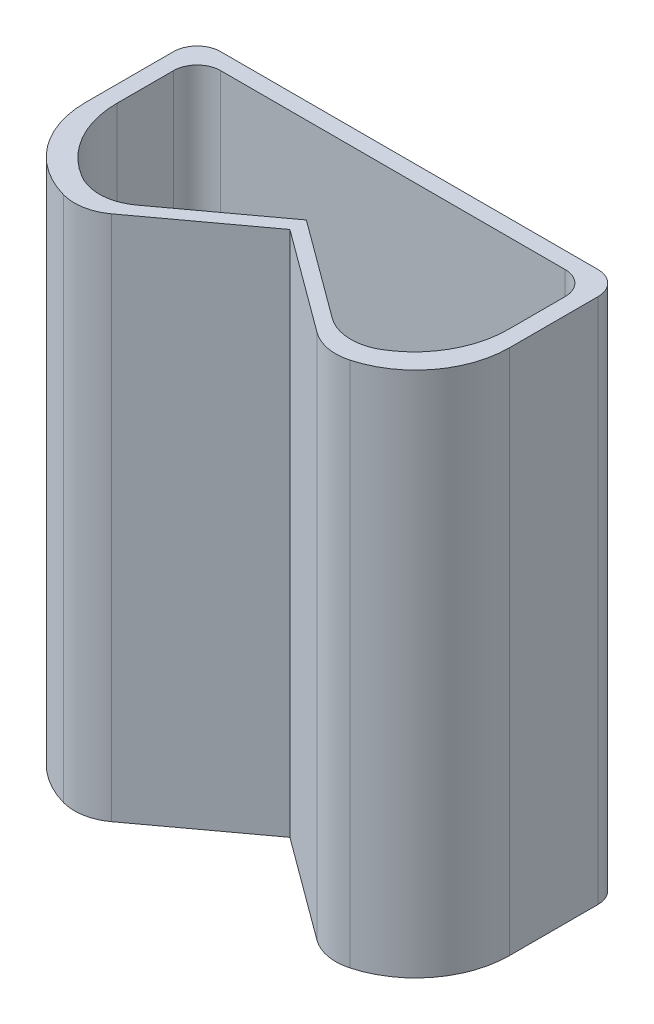
from build123d import *

# Parameters (mm, degrees)
SKETCH_1_W          = 9.03
SKETCH_1_H          = 11.2
EXTRUDE_1_DEPTH     = 4.38
FILLET_1_R          = 0.5
CUT_EXTRUDE_2_DEPTH = 14.38
FILLET_5_R          = 2
FILLET_6_R          = 1
FILLET_7_R          = 0.5


with BuildPart() as part:
    # 스케치1 → 보스-돌출1 (new body)
    with BuildSketch(Plane.XY):
        Rectangle(SKETCH_1_W, SKETCH_1_H)
    extrude(amount=EXTRUDE_1_DEPTH)

    # 필렛1
    fillet_1_edges = [part.edges().sort_by_distance(p)[0] for p in [
        (-4.515, 0, 0),
        (4.515, 0, 0),
    ]]
    fillet(fillet_1_edges, radius=FILLET_1_R)

    # 스케치2 → 컷-돌출2 (cut)
    with BuildSketch(Plane(origin=(0, 5.6, 0), x_dir=(1, 0, 0), z_dir=(0, 1, 0))):
        Polygon((4.165, -4.03), (4.165, -0.35), (-4.165, -0.35), (-4.165, -4.03), (-2.5, -4.03), (0, -2.19), (2.5, -4.03), align=None)
        Polygon((2.5, -4.38), (2.024456522, -4.03), (-2.024456522, -4.03), (-2.5, -4.38), align=None)
        Polygon((-2.024456522, -4.03), (2.024456522, -4.03), (0, -2.54), align=None)
    extrude(amount=-CUT_EXTRUDE_2_DEPTH, mode=Mode.SUBTRACT)

    # 필렛5
    # the kernel refuses this fillet: 2 mm, written as the material it adds along each edge
    with BuildSketch(Plane(origin=(4.165, 5.6, 4.03), x_dir=(-1, 0, 0), z_dir=(0, -1, 0))) as fillet_5_piece_1:
        with BuildLine():
            CenterArc((2, 1.971744152), FILLET_5_R, 180, 80.357504536)
            Line((0, 1.971744152), (0, 0))
            Line((0, 0), (1.665, 0))
        make_face()
    extrude(amount=11.2)
    with BuildSketch(Plane(origin=(-4.165, 5.6, 4.03), x_dir=(0, 0, -1), z_dir=(0, -1, 0))) as fillet_5_piece_2:
        with BuildLine():
            CenterArc((1.971744152, 2), FILLET_5_R, 189.642495464, 80.357504536)
            Line((0, 1.665), (0, 0))
            Line((0, 0), (1.971744152, 0))
        make_face()
    extrude(amount=11.2)
    # the kernel refuses this fillet: 2 mm, written as the material it takes off along each edge
    with BuildSketch(Plane(origin=(4.515, -10.6, 4.38), x_dir=(0, 0, -1), z_dir=(0, 1, 0))) as fillet_5_2_piece_1:
        with BuildLine():
            CenterArc((FILLET_5_R, FILLET_5_R), FILLET_5_R, 180, 90)
            Line((0, FILLET_5_R), (0, 0))
            Line((0, 0), (FILLET_5_R, 0))
        make_face()
    extrude(amount=21.2, mode=Mode.SUBTRACT)
    with BuildSketch(Plane(origin=(-4.515, 10.6, 4.38), x_dir=(1, 0, 0), z_dir=(0, -1, 0))) as fillet_5_2_piece_2:
        with BuildLine():
            CenterArc((FILLET_5_R, -FILLET_5_R), FILLET_5_R, 90, 90)
            Line((0, -FILLET_5_R), (0, 0))
            Line((0, 0), (FILLET_5_R, 0))
        make_face()
    extrude(amount=21.2, mode=Mode.SUBTRACT)

    # 필렛6
    fillet_6_edges = [part.edges().sort_by_distance(p)[0] for p in [
        (2.5, 0, 4.03),
        (2.5, 0, 4.38),
        (-2.5, 0, 4.38),
        (-2.5, 0, 4.03),
    ]]
    fillet(fillet_6_edges, radius=FILLET_6_R)

    # 필렛7
    fillet_7_edges = [part.edges().sort_by_distance(p)[0] for p in [
        (-4.165, 0, 0.35),
        (4.165, 0, 0.35),
    ]]
    fillet(fillet_7_edges, radius=FILLET_7_R)


solid = part.part
